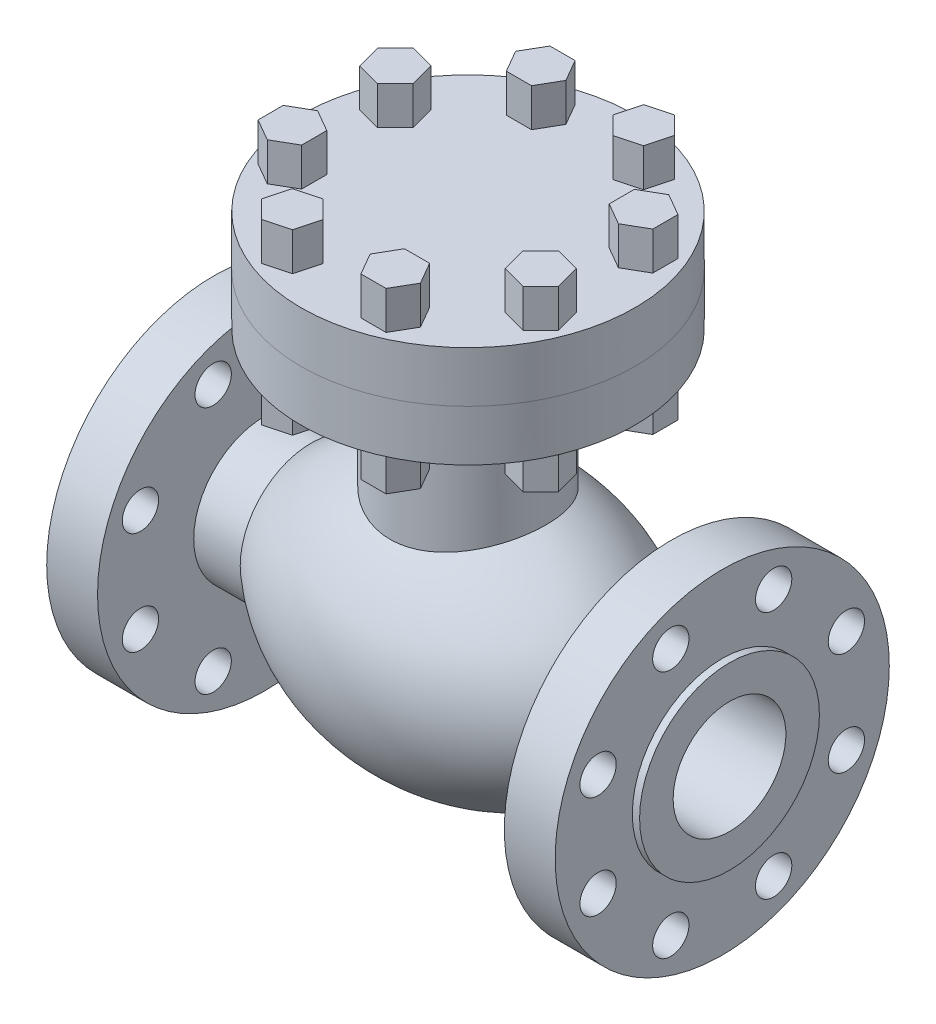
from build123d import *

# Parameters (mm, degrees)
FLOW_FLANGE_SKETCH_R          = 146.05
FLOW_FLANGE_DEPTH             = 50.8
HUB_CUT_SKETCH_OUTSIDE_W      = 417.336
HUB_CUT_SKETCH_OUTSIDE_H      = 417.336
HUB_CUT_SKETCH_OUTSIDE_R      = 78.613
HUB_CUT_DEPTH                 = 6.35
BOLT_HOLE_REACH               = 503.69
BOLT_HOLE_SKETCH_R            = 15.875
BOLT_HOLE_PATTERN_COUNT       = 8
BOLT_HOLE_PATTERN_ANGLE       = 315
FLANGE_MIRROR_COPY_1_REACH    = 503.69
FLANGE_MIRROR_COPY_1_SKETCH_R = 15.875
FLANGE_MIRROR_COPY_2_REACH    = 503.69
FLANGE_MIRROR_COPY_2_SKETCH_R = 15.875
FLANGE_MIRROR_COPY_3_REACH    = 503.69
FLANGE_MIRROR_COPY_3_SKETCH_R = 15.875
FLANGE_MIRROR_COPY_4_REACH    = 503.69
FLANGE_MIRROR_COPY_4_SKETCH_R = 15.875
FLANGE_MIRROR_COPY_5_REACH    = 503.69
FLANGE_MIRROR_COPY_5_SKETCH_R = 15.875
FLANGE_MIRROR_COPY_6_REACH    = 503.69
FLANGE_MIRROR_COPY_6_SKETCH_R = 15.875
FLANGE_MIRROR_COPY_7_REACH    = 503.69
FLANGE_MIRROR_COPY_7_SKETCH_R = 15.875
BODY_EXTRUDE_SKETCH_R         = 68.1736
BODY_EXTRUDE_DEPTH            = 306.07
FLANGE_BOTTOM_SKETCH_R        = 146.05
FLANGE_BOTTOM_DEPTH           = 44.45
FLANGE_TOP_SKETCH_R           = 146.05
FLANGE_TOP_DEPTH              = 44.45
ID_SKETCH_R                   = 49.276
ID_CUT_DEPTH                  = 570.246244959
BOLT_DEPTH                    = 155.575
BOLT_PATTERN_COUNT            = 8
BOLT_PATTERN_ANGLE            = 315


with BuildPart() as part:
    # Flow Extrude Sketch → Flow Extrude (revolve)
    with BuildSketch(Plane.XY):
        with BuildLine():
            Line((137.16, 61.976), (228.6, 61.976))
            Line((228.6, 61.976), (228.6, 0))
            Line((228.6, 0), (-228.6, 0))
            Line((-228.6, 0), (-228.6, 61.976))
            Line((-228.6, 61.976), (-137.16, 61.976))
            ThreePointArc((-137.16, 61.976), (0, 114.3), (137.16, 61.976))
        make_face()
    revolve(axis=Axis((-245.321131649, 0, 0), (1, 0, 0)))

    # Flow Flange Sketch → Flow Flange (add)
    with BuildSketch(Plane(origin=(228.6, 0, 0), x_dir=(0, 0, -1), z_dir=(1, 0, 0))):
        Circle(FLOW_FLANGE_SKETCH_R)
    flow_flange = extrude(amount=-FLOW_FLANGE_DEPTH)

    # Hub Cut Sketch outside → Hub Cut (cut)
    with BuildSketch(Plane(origin=(228.6, 0, 0), x_dir=(0, 0, -1), z_dir=(1, 0, 0))):
        Rectangle(HUB_CUT_SKETCH_OUTSIDE_W, HUB_CUT_SKETCH_OUTSIDE_H)
        Circle(HUB_CUT_SKETCH_OUTSIDE_R, mode=Mode.SUBTRACT)
    hub_cut = extrude(amount=-HUB_CUT_DEPTH, mode=Mode.SUBTRACT)

    # Bolt Hole Sketch → Bolt Hole (cut, up to next)
    with BuildSketch(Plane(origin=(228.6, 0, 0), x_dir=(0, 0, -1), z_dir=(1, 0, 0)), mode=Mode.PRIVATE) as bolt_hole_sk1:
        with Locations((44.955736217, 108.532748082)):
            Circle(BOLT_HOLE_SKETCH_R)
    bolt_hole_tool1 = extrude(bolt_hole_sk1.sketch, amount=-BOLT_HOLE_REACH, mode=Mode.PRIVATE) & part.part
    bolt_hole = bolt_hole_tool1.solids().sort_by_distance((228.6, 108.532748, -44.955736))[0]
    add(bolt_hole, mode=Mode.SUBTRACT)

    # Bolt Hole Pattern: Bolt Hole ×8 about axis
    bolt_hole_pattern_axis = Axis((-245.321131649, 0, 0), (1, 0, 0))
    for i in range(1, BOLT_HOLE_PATTERN_COUNT):
        add(bolt_hole.rotate(bolt_hole_pattern_axis, i * BOLT_HOLE_PATTERN_ANGLE / (BOLT_HOLE_PATTERN_COUNT - 1)), mode=Mode.SUBTRACT)

    # Flange Mirror: Flow Flange, Hub Cut, Bolt Hole across plane
    add(flow_flange.mirror(Plane(origin=(0, 0, 0), x_dir=(0, 0, 1), z_dir=(1, 0, 0))))
    add(hub_cut.mirror(Plane(origin=(0, 0, 0), x_dir=(0, 0, 1), z_dir=(1, 0, 0))), mode=Mode.SUBTRACT)
    add(bolt_hole.mirror(Plane(origin=(0, 0, 0), x_dir=(0, 0, 1), z_dir=(1, 0, 0))), mode=Mode.SUBTRACT)

    # Flange Mirror copy 1 sketch → Flange Mirror copy 1 (cut, up to next)
    with BuildSketch(Plane(origin=(-228.6, 0, 0), x_dir=(0, 0.7071067811865488, -0.7071067811865462), z_dir=(-1, 0, 0)), mode=Mode.PRIVATE) as flange_mirror_copy_1_sk1:
        with Locations((44.955736217, -108.532748082)):
            Circle(FLANGE_MIRROR_COPY_1_SKETCH_R)
    flange_mirror_copy_1_tool1 = extrude(flange_mirror_copy_1_sk1.sketch, amount=-FLANGE_MIRROR_COPY_1_REACH, mode=Mode.PRIVATE) & part.part
    add(flange_mirror_copy_1_tool1.solids().sort_by_distance((-228.6, 108.53274787, 44.955736313))[0], mode=Mode.SUBTRACT)

    # Flange Mirror copy 2 sketch → Flange Mirror copy 2 (cut, up to next)
    with BuildSketch(Plane(origin=(-228.6, 0, 0), x_dir=(0, 1, 0), z_dir=(-1, 0, 0)), mode=Mode.PRIVATE) as flange_mirror_copy_2_sk1:
        with Locations((44.955736217, -108.532748082)):
            Circle(FLANGE_MIRROR_COPY_2_SKETCH_R)
    flange_mirror_copy_2_tool1 = extrude(flange_mirror_copy_2_sk1.sketch, amount=-FLANGE_MIRROR_COPY_2_REACH, mode=Mode.PRIVATE) & part.part
    add(flange_mirror_copy_2_tool1.solids().sort_by_distance((-228.6, 44.955736, 108.532748))[0], mode=Mode.SUBTRACT)

    # Flange Mirror copy 3 sketch → Flange Mirror copy 3 (cut, up to next)
    with BuildSketch(Plane(origin=(-228.6, 0, 0), x_dir=(0, 0.7071067811865441, 0.7071067811865509), z_dir=(-1, 0, 0)), mode=Mode.PRIVATE) as flange_mirror_copy_3_sk1:
        with Locations((44.955736217, -108.532748082)):
            Circle(FLANGE_MIRROR_COPY_3_SKETCH_R)
    flange_mirror_copy_3_tool1 = extrude(flange_mirror_copy_3_sk1.sketch, amount=-FLANGE_MIRROR_COPY_3_REACH, mode=Mode.PRIVATE) & part.part
    add(flange_mirror_copy_3_tool1.solids().sort_by_distance((-228.6, -44.955736313, 108.53274787))[0], mode=Mode.SUBTRACT)

    # Flange Mirror copy 4 sketch → Flange Mirror copy 4 (cut, up to next)
    with BuildSketch(Plane.ZY.offset(228.6), mode=Mode.PRIVATE) as flange_mirror_copy_4_sk1:
        with Locations((44.955736217, -108.532748082)):
            Circle(FLANGE_MIRROR_COPY_4_SKETCH_R)
    flange_mirror_copy_4_tool1 = extrude(flange_mirror_copy_4_sk1.sketch, amount=-FLANGE_MIRROR_COPY_4_REACH, mode=Mode.PRIVATE) & part.part
    add(flange_mirror_copy_4_tool1.solids().sort_by_distance((-228.6, -108.532748, 44.955736))[0], mode=Mode.SUBTRACT)

    # Flange Mirror copy 5 sketch → Flange Mirror copy 5 (cut, up to next)
    with BuildSketch(Plane(origin=(-228.6, 0, 0), x_dir=(0, -0.7071067811865537, 0.7071067811865414), z_dir=(-1, 0, 0)), mode=Mode.PRIVATE) as flange_mirror_copy_5_sk1:
        with Locations((44.955736217, -108.532748082)):
            Circle(FLANGE_MIRROR_COPY_5_SKETCH_R)
    flange_mirror_copy_5_tool1 = extrude(flange_mirror_copy_5_sk1.sketch, amount=-FLANGE_MIRROR_COPY_5_REACH, mode=Mode.PRIVATE) & part.part
    add(flange_mirror_copy_5_tool1.solids().sort_by_distance((-228.6, -108.53274787, -44.955736313))[0], mode=Mode.SUBTRACT)

    # Flange Mirror copy 6 sketch → Flange Mirror copy 6 (cut, up to next)
    with BuildSketch(Plane(origin=(-228.6, 0, 0), x_dir=(0, -1, 0), z_dir=(-1, 0, 0)), mode=Mode.PRIVATE) as flange_mirror_copy_6_sk1:
        with Locations((44.955736217, -108.532748082)):
            Circle(FLANGE_MIRROR_COPY_6_SKETCH_R)
    flange_mirror_copy_6_tool1 = extrude(flange_mirror_copy_6_sk1.sketch, amount=-FLANGE_MIRROR_COPY_6_REACH, mode=Mode.PRIVATE) & part.part
    add(flange_mirror_copy_6_tool1.solids().sort_by_distance((-228.6, -44.955736, -108.532748))[0], mode=Mode.SUBTRACT)

    # Flange Mirror copy 7 sketch → Flange Mirror copy 7 (cut, up to next)
    with BuildSketch(Plane(origin=(-228.6, 0, 0), x_dir=(0, -0.7071067811865389, -0.7071067811865561), z_dir=(-1, 0, 0)), mode=Mode.PRIVATE) as flange_mirror_copy_7_sk1:
        with Locations((44.955736217, -108.532748082)):
            Circle(FLANGE_MIRROR_COPY_7_SKETCH_R)
    flange_mirror_copy_7_tool1 = extrude(flange_mirror_copy_7_sk1.sketch, amount=-FLANGE_MIRROR_COPY_7_REACH, mode=Mode.PRIVATE) & part.part
    add(flange_mirror_copy_7_tool1.solids().sort_by_distance((-228.6, 44.955736313, -108.53274787))[0], mode=Mode.SUBTRACT)

    # Body Extrude Sketch → Body Extrude (add)
    with BuildSketch(Plane(origin=(0, 0, 0), x_dir=(1, 0, 0), z_dir=(0, 1, 0))):
        Circle(BODY_EXTRUDE_SKETCH_R)
    extrude(amount=BODY_EXTRUDE_DEPTH)

    # Flange Bottom Sketch → Flange Bottom (add)
    with BuildSketch(Plane(origin=(0, 306.07, 0), x_dir=(-1, 0, 0), z_dir=(0, 1, 0))):
        Circle(FLANGE_BOTTOM_SKETCH_R)
    extrude(amount=-FLANGE_BOTTOM_DEPTH)

    # Flange Top Sketch → Flange Top (add)
    with BuildSketch(Plane.XZ.offset(-261.62)):
        Circle(FLANGE_TOP_SKETCH_R)
    extrude(amount=FLANGE_TOP_DEPTH)

    # ID Sketch → ID Cut (cut, through all)
    with BuildSketch(Plane.ZY.offset(-228.6)):
        Circle(ID_SKETCH_R)
    extrude(amount=ID_CUT_DEPTH, mode=Mode.SUBTRACT)

    # Bolt Sketch → Bolt (add)
    with BuildSketch(Plane(origin=(0, 339.4075, 0), x_dir=(-1, 0, 0), z_dir=(0, 1, 0))):
        Polygon((-108.532748082, -22.958690961), (-127.582748082, -33.957213589), (-127.582748082, -55.954258845), (-108.532748082, -66.952781473), (-89.482748082, -55.954258845), (-89.482748082, -33.957213589), align=None)
    bolt = extrude(amount=-BOLT_DEPTH)

    # Bolt Pattern: Bolt ×8 about axis
    bolt_pattern_axis = Axis((0, 261.62, 0), (0, 1, 0))
    for i in range(1, BOLT_PATTERN_COUNT):
        add(bolt.rotate(bolt_pattern_axis, i * BOLT_PATTERN_ANGLE / (BOLT_PATTERN_COUNT - 1)))


solid = part.part
